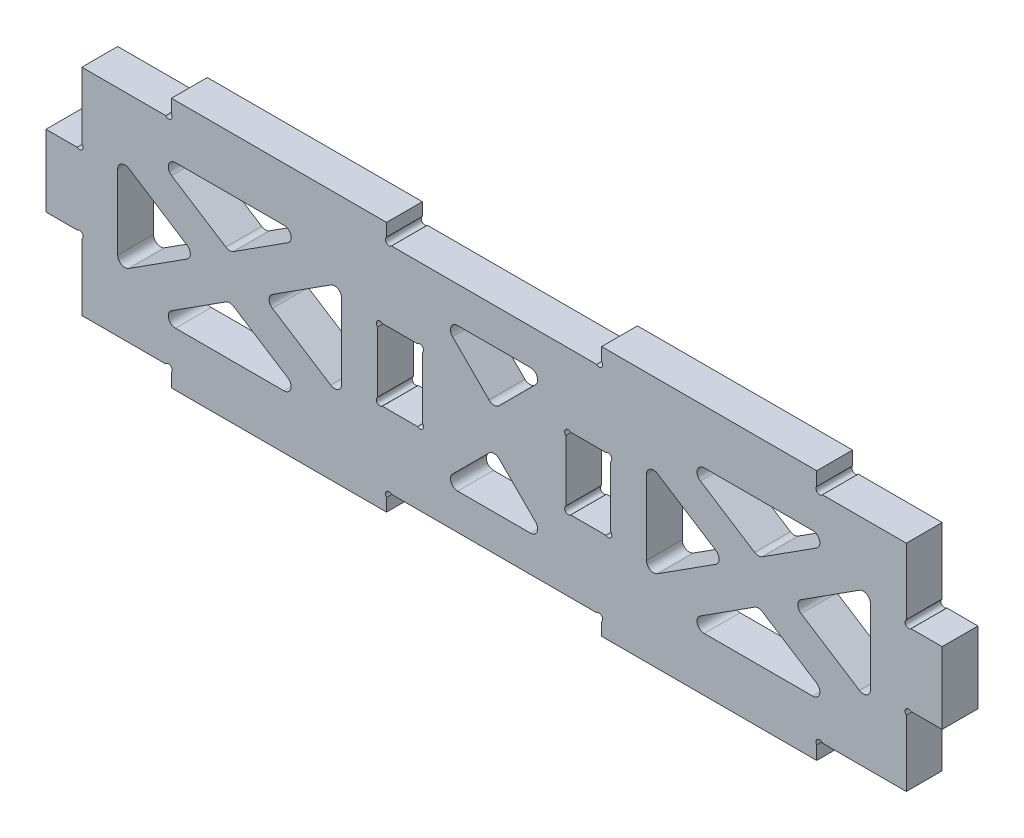
from build123d import *

# Parameters (mm, degrees)
SKETCH1_W           = 317.5
SKETCH1_H           = 76.2
BOSS_EXTRUDE1_DEPTH = 12.7
SKETCH2_W           = 76.2
SKETCH2_H           = 6.35
BOSS_EXTRUDE2_DEPTH = 12.7
SKETCH3_W           = 12.7
SKETCH3_H           = 25.4
SKETCH3_W_2         = 15.875
CUT_EXTRUDE1_DEPTH  = 166.344050392
SKETCH7_R           = 1.27
CUT_EXTRUDE4_DEPTH  = 166.344050392
SKETCH8_R           = 1.27
CUT_EXTRUDE5_DEPTH  = 166.344050392
CUT_EXTRUDE6_DEPTH  = 166.344050392
FILLET1_R           = 2.54


with BuildPart() as part:
    # Sketch1 → Boss-Extrude1 (new body)
    with BuildSketch(Plane.XY):
        Rectangle(SKETCH1_W, SKETCH1_H)
    extrude(amount=BOSS_EXTRUDE1_DEPTH)

    # Sketch2 → Boss-Extrude2 (add)
    with BuildSketch(Plane.XY.offset(12.7)):
        with Locations((-76.2, -41.275)):
            Rectangle(SKETCH2_W, SKETCH2_H)
        with Locations((76.2, -41.275)):
            Rectangle(SKETCH2_W, SKETCH2_H)
        with Locations((76.2, 41.275)):
            Rectangle(SKETCH2_W, SKETCH2_H)
        with Locations((-76.2, 41.275)):
            Rectangle(SKETCH2_W, SKETCH2_H)
    extrude(amount=-BOSS_EXTRUDE2_DEPTH)

    # Sketch3 → Cut-Extrude1 (cut, through all)
    with BuildSketch(Plane.XY.offset(12.7)):
        with Locations((-152.4, -25.4)):
            Rectangle(SKETCH3_W, SKETCH3_H)
        with Locations((-152.4, 25.4)):
            Rectangle(SKETCH3_W, SKETCH3_H)
        with Locations((152.4, 25.4)):
            Rectangle(SKETCH3_W, SKETCH3_H)
        with Locations((152.4, -25.4)):
            Rectangle(SKETCH3_W, SKETCH3_H)
        with Locations((33.3375, 0)):
            Rectangle(SKETCH3_W_2, SKETCH3_H)
        with Locations((-33.3375, 0)):
            Rectangle(SKETCH3_W_2, SKETCH3_H)
    extrude(amount=-CUT_EXTRUDE1_DEPTH, mode=Mode.SUBTRACT)

    # Sketch7 → Cut-Extrude4 (cut, through all)
    with BuildSketch(Plane.XY.offset(12.7)):
        with Locations((-115.322216931, -38.853639533)):
            Circle(SKETCH7_R)
        with Locations((-37.219883345, -39.015584335)):
            Circle(SKETCH7_R)
        with Locations((37.219883345, -39.015584335)):
            Circle(SKETCH7_R)
        with Locations((115.322216931, -38.853639533)):
            Circle(SKETCH7_R)
        with Locations((115.322216931, 38.853639533)):
            Circle(SKETCH7_R)
        with Locations((37.219883345, 39.015584335)):
            Circle(SKETCH7_R)
        with Locations((-37.219883345, 39.015584335)):
            Circle(SKETCH7_R)
        with Locations((-115.322216931, 38.853639533)):
            Circle(SKETCH7_R)
        with Locations((-146.889550892, -13.652918832)):
            Circle(SKETCH7_R)
        with Locations((-146.889550892, 13.652918832)):
            Circle(SKETCH7_R)
        with Locations((146.889550892, -13.652918832)):
            Circle(SKETCH7_R)
        with Locations((146.889550892, 13.652918832)):
            Circle(SKETCH7_R)
    extrude(amount=-CUT_EXTRUDE4_DEPTH, mode=Mode.SUBTRACT)

    # Sketch8 → Cut-Extrude5 (cut, through all)
    with BuildSketch(Plane.XY.offset(12.7)):
        with Locations((-40.441329163, 11.741932708)):
            Circle(SKETCH8_R)
        with Locations((-26.266083676, 11.771130221)):
            Circle(SKETCH8_R)
        with Locations((-26.266083676, -11.771130221)):
            Circle(SKETCH8_R)
        with Locations((-40.441329163, -11.741932708)):
            Circle(SKETCH8_R)
        with Locations((40.441329163, -11.741932708)):
            Circle(SKETCH8_R)
        with Locations((26.266083676, -11.771130221)):
            Circle(SKETCH8_R)
        with Locations((26.266083676, 11.771130221)):
            Circle(SKETCH8_R)
        with Locations((40.441329163, 11.741932708)):
            Circle(SKETCH8_R)
    extrude(amount=-CUT_EXTRUDE5_DEPTH, mode=Mode.SUBTRACT)

    # Sketch4 → Cut-Extrude6 (cut, through all)
    with BuildSketch(Plane.XY.offset(12.7)):
        Polygon((-93.6625, -7.539137616), (-121.570097474, -25.4), (-65.754902526, -25.4), align=None)
        Polygon((-133.35, 17.860862384), (-133.35, -17.860862384), (-105.442402526, 0), align=None)
        Polygon((-81.882597474, 0), (-53.975, -17.860862384), (-53.975, 17.860862384), align=None)
        Polygon((-65.754902526, 25.4), (-121.570097474, 25.4), (-93.6625, 7.539137616), align=None)
        Polygon((19.05, 25.4), (-19.05, 25.4), (0, 6.35), align=None)
        Polygon((0, -6.35), (-19.05, -25.4), (19.05, -25.4), align=None)
    cut_extrude6 = extrude(amount=-CUT_EXTRUDE6_DEPTH, mode=Mode.SUBTRACT)

    # Mirror1: Cut-Extrude6 across plane
    add(cut_extrude6.mirror(Plane(origin=(0, 0, 0), x_dir=(0, 0, 1), z_dir=(1, 0, 0))), mode=Mode.SUBTRACT)

    # Fillet1
    fillet1_edges = [part.edges().sort_by_distance(p)[0] for p in [
        (-19.05, -25.4, 6.35),
        (-19.05, 25.4, 6.35),
        (-133.35, 17.860862384, 6.35),
        (-65.754902526, -25.4, 6.35),
        (-121.570097474, -25.4, 6.35),
        (-133.35, -17.860862384, 6.35),
        (-53.975, -17.860862384, 6.35),
        (-53.975, 17.860862384, 6.35),
        (-105.442402526, 0, 6.35),
        (-65.754902526, 25.4, 6.35),
        (-93.6625, 7.539137616, 6.35),
        (-93.6625, -7.539137616, 6.35),
        (-81.882597474, 0, 6.35),
        (-121.570097474, 25.4, 6.35),
        (65.754902526, 25.4, 6.35),
        (121.570097474, 25.4, 6.35),
        (133.35, 17.860862384, 6.35),
        (105.442402526, 0, 6.35),
        (65.754902526, -25.4, 6.35),
        (121.570097474, -25.4, 6.35),
        (93.6625, -7.539137616, 6.35),
        (81.882597474, 0, 6.35),
        (53.975, 17.860862384, 6.35),
        (53.975, -17.860862384, 6.35),
        (93.6625, 7.539137616, 6.35),
        (133.35, -17.860862384, 6.35),
        (19.05, -25.4, 6.35),
        (0, -6.35, 6.35),
        (19.05, 25.4, 6.35),
        (0, 6.35, 6.35),
    ]]
    fillet(fillet1_edges, radius=FILLET1_R)


solid = part.part
